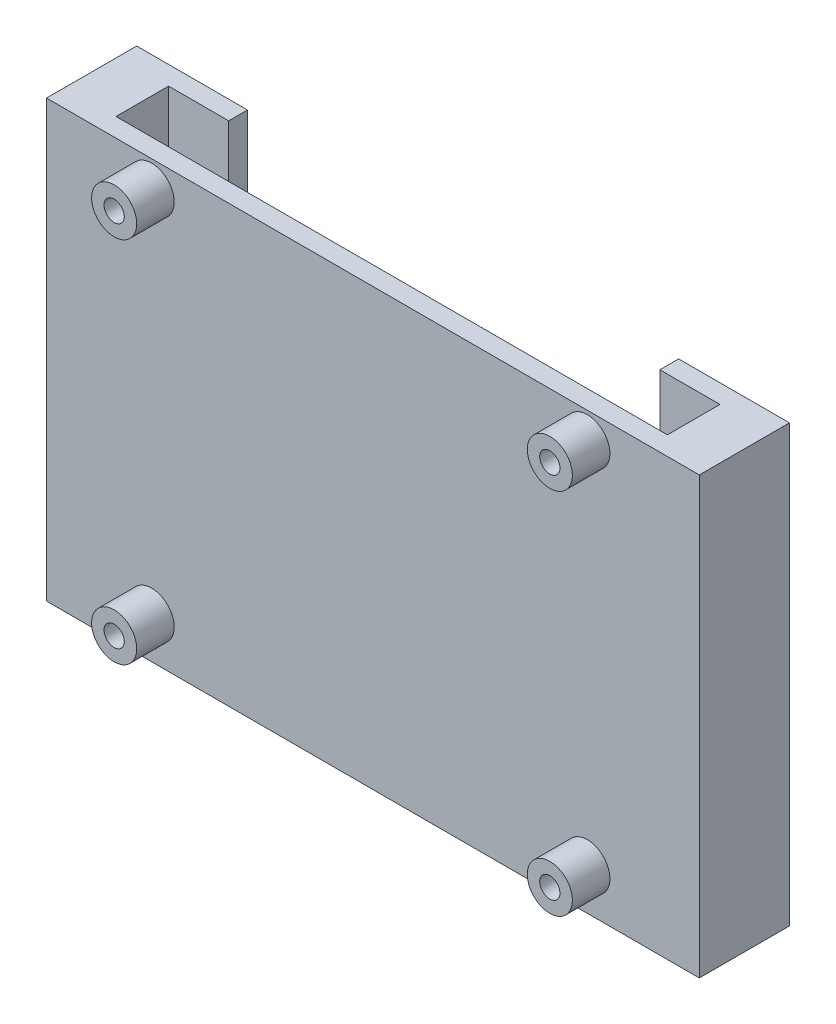
from build123d import *

# Parameters (mm, degrees)
SKETCH1_W              = 86.9
SKETCH1_H              = 58
BOSS_EXTRUDE1_DEPTH    = 2.5
SKETCH2_R              = 3
BOSS_EXTRUDE2_DEPTH    = 5
LPATTERN1_COUNT        = 2
LPATTERN1_PITCH        = 49
M2_5_CLEARANCE_HOLE1_D = 2.7
SKETCH6_W              = 6.75
SKETCH6_H              = 58
BOSS_EXTRUDE3_DEPTH    = 9.5
SKETCH7_W              = 2.5
SKETCH7_H              = 58
BOSS_EXTRUDE4_DEPTH    = 8
SKETCH8_W              = 2.5
SKETCH8_H              = 58
BOSS_EXTRUDE5_DEPTH    = 8
SKETCH9_R              = 3.15
CUT_EXTRUDE1_DEPTH     = 2.7


with BuildPart() as part:
    # Sketch1 → Boss-Extrude1 (new body)
    with BuildSketch(Plane.XY):
        Rectangle(SKETCH1_W, SKETCH1_H)
    extrude(amount=BOSS_EXTRUDE1_DEPTH)

    # Sketch2 → Boss-Extrude2 (add)
    with BuildSketch(Plane.XY.offset(2.5)):
        with Locations((-29.45, 25.5)):
            Circle(SKETCH2_R)
        with Locations((28.55, 25.5)):
            Circle(SKETCH2_R)
    boss_extrude2 = extrude(amount=BOSS_EXTRUDE2_DEPTH)

    # LPattern1: Boss-Extrude2 ×2
    with Locations(*[(0, -i * LPATTERN1_PITCH, 0) for i in range(1, LPATTERN1_COUNT)]):
        add(boss_extrude2)

    # M2.5 Clearance Hole1 (through all)
    with Locations(Plane.XY.offset(7.5)):
        with Locations((-29.45, 25.5), (-29.45, -23.5), (28.55, 25.5), (28.55, -23.5)):
            Hole(M2_5_CLEARANCE_HOLE1_D / 2)

    # Sketch6 → Boss-Extrude3 (add)
    with BuildSketch(Plane(origin=(0, 0, 0), x_dir=(-1, 0, 0), z_dir=(0, 0, -1))):
        with Locations((-40.075, 0)):
            Rectangle(SKETCH6_W, SKETCH6_H)
        with Locations((40.075, 0)):
            Rectangle(SKETCH6_W, SKETCH6_H)
    extrude(amount=BOSS_EXTRUDE3_DEPTH)

    # Sketch7 → Boss-Extrude4 (add)
    with BuildSketch(Plane.ZY.offset(-36.7)):
        with Locations((-8.25, 0)):
            Rectangle(SKETCH7_W, SKETCH7_H)
    extrude(amount=BOSS_EXTRUDE4_DEPTH)

    # Sketch8 → Boss-Extrude5 (add)
    with BuildSketch(Plane(origin=(-36.7, 0, 0), x_dir=(0, 0, -1), z_dir=(1, 0, 0))):
        with Locations((8.25, 0)):
            Rectangle(SKETCH8_W, SKETCH8_H)
    extrude(amount=BOSS_EXTRUDE5_DEPTH)

    # Sketch9 → Cut-Extrude1 (cut)
    with BuildSketch(Plane.XZ.offset(29)):
        with Locations((-40.075, -3.5)):
            Circle(SKETCH9_R)
        with Locations((40.075, -3.5)):
            Circle(SKETCH9_R)
    extrude(amount=-CUT_EXTRUDE1_DEPTH, mode=Mode.SUBTRACT)


solid = part.part
